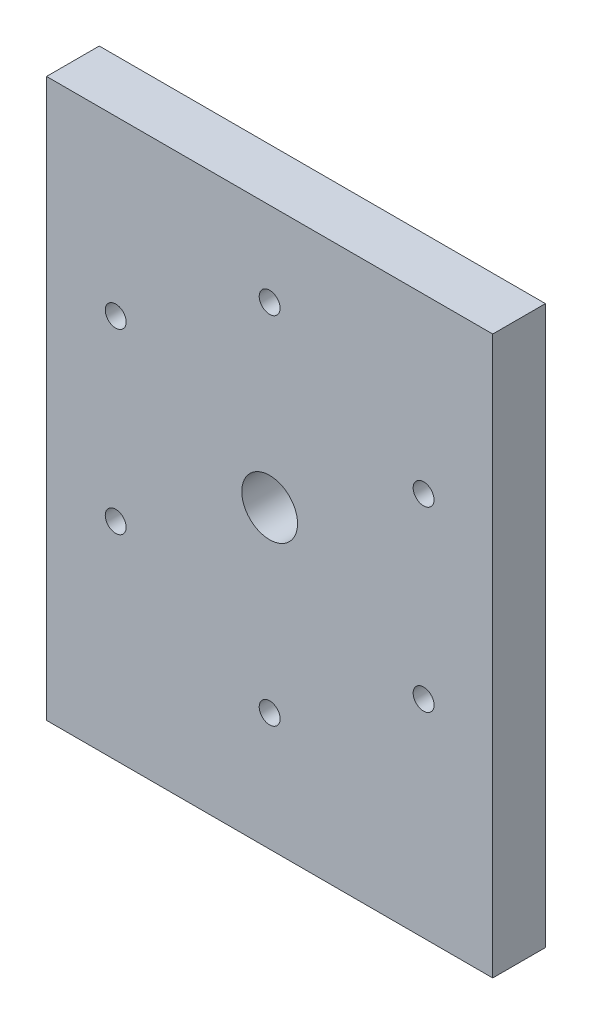
from build123d import *

# Parameters (mm, degrees)
SKETCH1_W                  = 101.6
SKETCH1_H                  = 127
SKETCH1_R                  = 6.35
BOSS_EXTRUDE1_DEPTH        = 12.0000014
SKETCH2_R                  = 2.38125
CUT_EXTRUDE1_DEPTH         = 138.308557758
CIRPATTERN1_COUNT          = 6
SKETCH3_R                  = 1.27
CUT_EXTRUDE2_DEPTH         = 12.7
F_10_32_TAPPED_HOLE3_D     = 4.0386
F_10_32_TAPPED_HOLE3_DEPTH = 12.7
F_10_32_TAPPED_HOLE3_TIP   = 1.213317848


with BuildPart() as part:
    # Sketch1 → Boss-Extrude1 (new body)
    with BuildSketch(Plane.XY):
        with Locations((0, 63.5)):
            Rectangle(SKETCH1_W, SKETCH1_H)
        with Locations((0, 67.3749986)):
            Circle(SKETCH1_R, mode=Mode.SUBTRACT)
    extrude(amount=BOSS_EXTRUDE1_DEPTH)

    # Sketch2 → Cut-Extrude1 (cut, through all)
    with BuildSketch(Plane(origin=(0, 0, 0), x_dir=(-1, 0, 0), z_dir=(0, 0, -1))):
        with Locations((0, 107.8562486)):
            Circle(SKETCH2_R)
    cut_extrude1 = extrude(amount=-CUT_EXTRUDE1_DEPTH, mode=Mode.SUBTRACT)

    # CirPattern1: Cut-Extrude1 ×6 about axis
    cirpattern1_axis = Axis((0, 67.3749986, 12.0000014), (0, 0, -1))
    for i in range(1, CIRPATTERN1_COUNT):
        add(cut_extrude1.rotate(cirpattern1_axis, i * 360 / CIRPATTERN1_COUNT), mode=Mode.SUBTRACT)

    # Sketch3 → Cut-Extrude2 (cut)
    with BuildSketch(Plane.XZ):
        with Locations((31.75, 6.0000007)):
            Circle(SKETCH3_R)
        with Locations((0, 6.0000007)):
            Circle(SKETCH3_R)
        with Locations((-31.75, 6.0000007)):
            Circle(SKETCH3_R)
    extrude(amount=-CUT_EXTRUDE2_DEPTH, mode=Mode.SUBTRACT)

    # #10-32 Tapped Hole3
    with Locations(Plane(origin=(0, 0, 0), x_dir=(-1, 0, 0), z_dir=(0, -1, 0))):
        with Locations((-31.75, -6.0000007), (0, -6.0000007), (31.75, -6.0000007)):
            Hole(F_10_32_TAPPED_HOLE3_D / 2, depth=F_10_32_TAPPED_HOLE3_DEPTH)
            with Locations((0, 0, -(F_10_32_TAPPED_HOLE3_DEPTH + F_10_32_TAPPED_HOLE3_TIP / 2))):  # 118° drill point
                Cone(0, F_10_32_TAPPED_HOLE3_D / 2, F_10_32_TAPPED_HOLE3_TIP, mode=Mode.SUBTRACT)


solid = part.part
